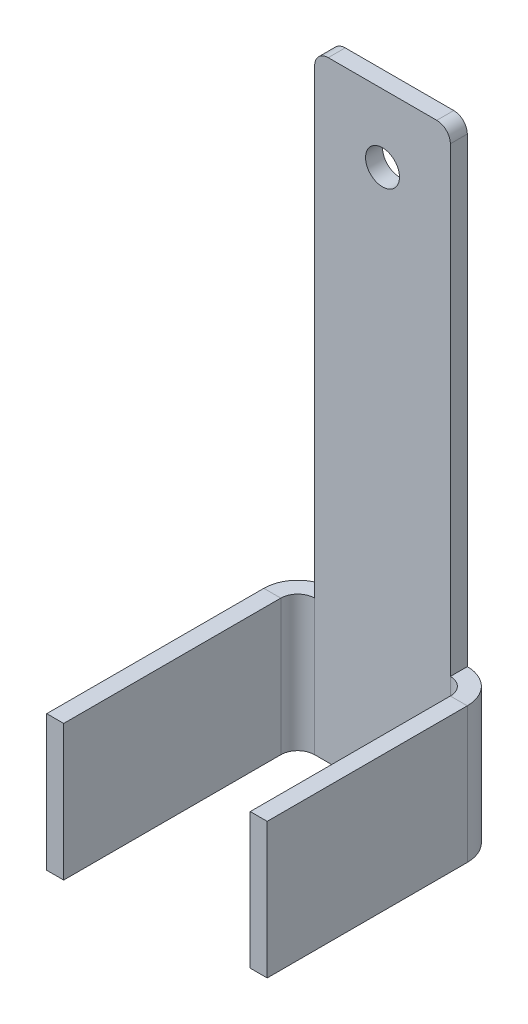
from build123d import *

# Parameters (mm, degrees)
SKETCH2_W              = 38.1
SKETCH2_H              = 25.4
BOSS_EXTRUDE1_DEPTH    = 3.175
SKETCH20_W             = 46.99
SKETCH20_H             = 25.4
BOSS_EXTRUDE5_DEPTH    = 3.175
SKETCH25_W             = 43.815
SKETCH25_H             = 25.4
BOSS_EXTRUDE6_DEPTH    = 3.175
CONVERT_SOLID2_START   = -12.7
CONVERT_SOLID2_DEPTH   = 25.4
CONVERT_SOLID2_2_DEPTH = 25.4
SKETCH16_W             = 25.4
SKETCH16_H             = 88.9
BOSS_EXTRUDE3_DEPTH    = 3.175
SKETCH17_R             = 3.175
CUT_EXTRUDE1_DEPTH     = 114.549648172
FILLET1_R              = 2.54


# Read off the part's stored shape, not the designer's step: Convert-Solid2
with BuildPart() as part:
    # Sketch2 → Boss-Extrude1 (new body)
    with BuildSketch(Plane.XY):
        Rectangle(SKETCH2_W, SKETCH2_H)
    extrude(amount=BOSS_EXTRUDE1_DEPTH)

    # Sketch20 → Boss-Extrude5 (add)
    with BuildSketch(Plane.ZY.offset(19.05)):
        with Locations((23.495, 0)):
            Rectangle(SKETCH20_W, SKETCH20_H)
    extrude(amount=-BOSS_EXTRUDE5_DEPTH)

    # Sketch25 → Boss-Extrude6 (add)
    with BuildSketch(Plane(origin=(19.05, 0, 0), x_dir=(0, 0, -1), z_dir=(1, 0, 0))):
        with Locations((-21.9075, 0)):
            Rectangle(SKETCH25_W, SKETCH25_H)
    extrude(amount=-BOSS_EXTRUDE6_DEPTH)

    # Convert-Solid2 outline → Convert-Solid2 (cut)
    with BuildSketch(Plane(origin=(0, 0, 0), x_dir=(1, 0, 0), z_dir=(0, 1, 0)).offset(CONVERT_SOLID2_START)):
        with BuildLine():
            Line((19.05, 0), (12.7, 0))
            ThreePointArc((12.7, 0), (17.190128061, -1.859871939), (19.05, -6.35))
            Line((19.05, -6.35), (19.05, 0))
        make_face()
        with BuildLine():
            ThreePointArc((-19.05, -6.35), (-17.190128061, -1.859871939), (-12.7, 0))
            Line((-12.7, 0), (-19.05, 0))
            Line((-19.05, 0), (-19.05, -6.35))
        make_face()
    extrude(amount=CONVERT_SOLID2_DEPTH, mode=Mode.SUBTRACT)

    # Convert-Solid2 2 outline → Convert-Solid2 2 (add)
    with BuildSketch(Plane(origin=(0, 0, 0), x_dir=(1, 0, 0), z_dir=(0, 1, 0)).offset(CONVERT_SOLID2_START)):
        with BuildLine():
            Line((15.875, -3.175), (12.7, -3.175))
            ThreePointArc((12.7, -3.175), (14.94506403, -4.10493597), (15.875, -6.35))
            Line((15.875, -6.35), (15.875, -3.175))
        make_face()
        with BuildLine():
            ThreePointArc((-15.875, -6.35), (-14.94506403, -4.10493597), (-12.7, -3.175))
            Line((-12.7, -3.175), (-15.875, -3.175))
            Line((-15.875, -3.175), (-15.875, -6.35))
        make_face()
    extrude(amount=CONVERT_SOLID2_2_DEPTH)

    # Sketch16 → Boss-Extrude3 (add)
    with BuildSketch(Plane(origin=(0, 0, 0), x_dir=(-1, 0, 0), z_dir=(0, 0, -1))):
        with Locations((0, 57.15)):
            Rectangle(SKETCH16_W, SKETCH16_H)
    extrude(amount=-BOSS_EXTRUDE3_DEPTH)

    # Sketch17 → Cut-Extrude1 (cut, through all)
    with BuildSketch(Plane(origin=(0, 0, 0), x_dir=(-1, 0, 0), z_dir=(0, 0, -1))):
        with Locations((0, 88.9)):
            Circle(SKETCH17_R)
    extrude(amount=-CUT_EXTRUDE1_DEPTH, mode=Mode.SUBTRACT)

    # Fillet1
    fillet1_edges = [part.edges().sort_by_distance(p)[0] for p in [
        (12.7, 101.6, 1.5875),
        (-12.7, 101.6, 1.5875),
    ]]
    fillet(fillet1_edges, radius=FILLET1_R)


solid = part.part
